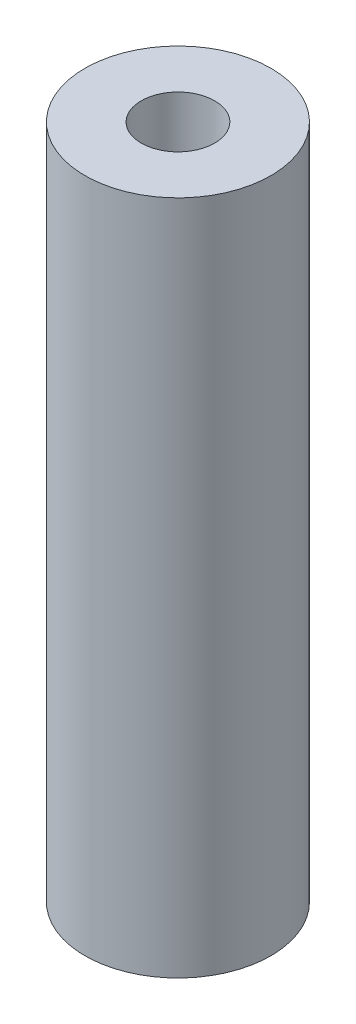
from build123d import *

# Parameters (mm, degrees)
SKETCH2_R           = 5.2451
SKETCH2_R_2         = 2.0701
BOSS_EXTRUDE1_DEPTH = 19.05


with BuildPart() as part:
    # Sketch2 → Boss-Extrude1 (new, symmetric)
    with BuildSketch(Plane(origin=(0, 0, 0), x_dir=(1, 0, 0), z_dir=(0, 1, 0))):
        Circle(SKETCH2_R)
        Circle(SKETCH2_R_2, mode=Mode.SUBTRACT)
    extrude(amount=BOSS_EXTRUDE1_DEPTH, both=True)


solid = part.part
